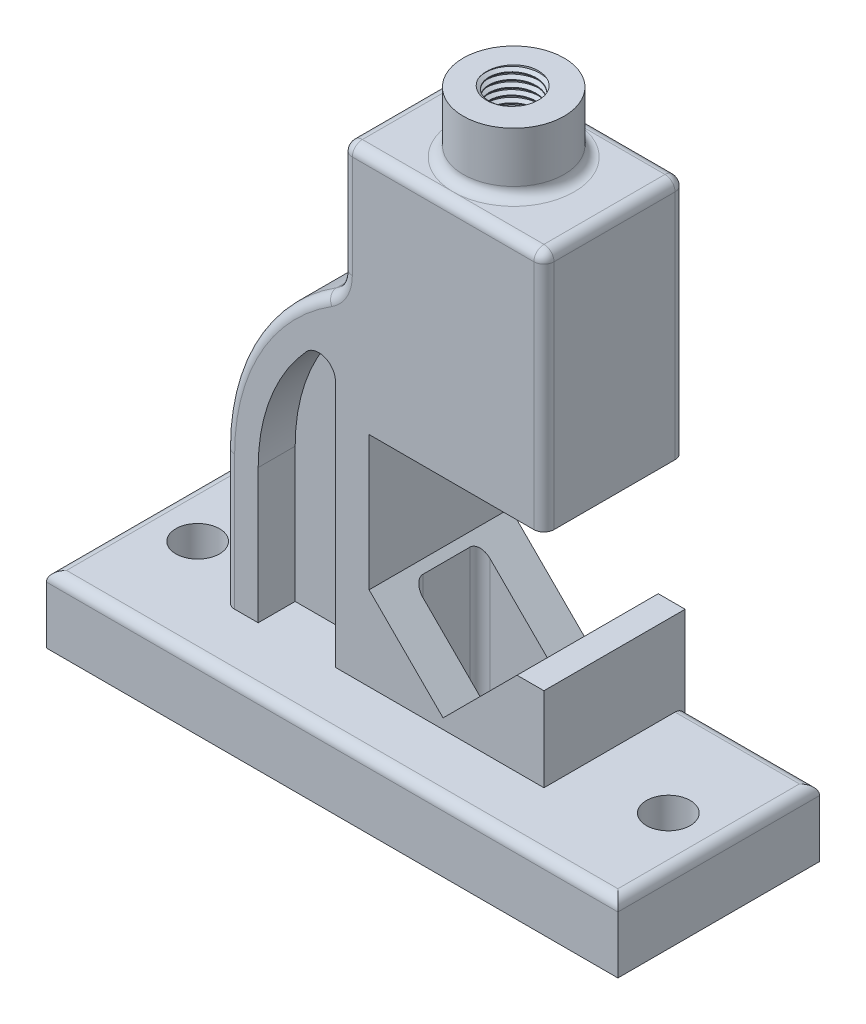
from build123d import *

# Parameters (mm, degrees)
BOSS_EXTRUDE1_DEPTH    = 60
BOSS_EXTRUDE2_DEPTH    = 42
SKETCH2_R              = 6.5
CUT_EXTRUDE1_DEPTH     = 60
BOSS_EXTRUDE3_START    = 11
BOSS_EXTRUDE3_DEPTH    = 20
CUT_EXTRUDE2_START     = 11
SKETCH3_W              = 40
SKETCH3_H              = 147
CUT_EXTRUDE2_DEPTH     = 20
SKETCH4_R              = 15
BOSS_EXTRUDE4_DEPTH    = 18
M16X2_0_TAPPED_HOLE1_D = 14
FILLET1_R              = 3
FILLET2_R              = 3
THREAD1_PITCH          = 2


with BuildPart() as part:
    # Sketch1 → Boss-Extrude1 (new body)
    with BuildSketch(Plane.XY):
        Polygon((-100, 20), (-100, 0), (-55, 0), (70, 0), (70, 20), (30, 20), (-32, 20), (-55, 20), (-65, 20), align=None)
    extrude(amount=BOSS_EXTRUDE1_DEPTH)

    # Sketch1<3> → Boss-Extrude2 (add)
    with BuildSketch(Plane.XY):
        with BuildLine():
            Line((-65, 60), (-65, 20))
            Line((-65, 20), (-55, 20))
            Line((-55, 20), (-55, 60))
            ThreePointArc((-55, 60), (-51.300584792, 79.830532015), (-40.7, 96.993377786))
            ThreePointArc((-40.7, 96.993377786), (-35.197224362, 98.294032968), (-32, 93.630343442))
            Line((-32, 93.630343442), (-32, 20))
            Line((-32, 20), (30, 20))
            Line((30, 20), (30, 45))
            Line((30, 45), (22, 45))
            Line((22, 45), (0, 23))
            Line((0, 23), (-22, 45))
            Line((-22, 45), (-22, 85))
            Line((-22, 85), (-20, 85))
            Line((-20, 85), (20, 85))
            Line((20, 85), (30, 85))
            Line((30, 85), (30, 157))
            Line((30, 157), (20, 157))
            Line((20, 157), (-20, 157))
            Line((-20, 157), (-30, 157))
            Line((-30, 157), (-30, 123.442887702))
            ThreePointArc((-30, 123.442887702), (-31.244049642, 118.612428787), (-34.666666667, 114.983836009))
            ThreePointArc((-34.666666667, 114.983836009), (-56.913677325, 91.39798295), (-65, 60))
        make_face()
    extrude(amount=BOSS_EXTRUDE2_DEPTH)

    # Sketch2 → Cut-Extrude1 (cut)
    with BuildSketch(Plane.XZ):
        with Locations((-85, 30)):
            Circle(SKETCH2_R)
        with Locations((55, 30)):
            Circle(SKETCH2_R)
    extrude(amount=-CUT_EXTRUDE1_DEPTH, mode=Mode.SUBTRACT)

    # Sketch1<6> → Boss-Extrude3 (add)
    with BuildSketch(Plane.XY.offset(BOSS_EXTRUDE3_START)):
        with BuildLine():
            Line((-55, 60), (-55, 20))
            Line((-55, 20), (-32, 20))
            Line((-32, 20), (-32, 93.630343442))
            ThreePointArc((-32, 93.630343442), (-35.197224362, 98.294032968), (-40.7, 96.993377786))
            ThreePointArc((-40.7, 96.993377786), (-51.300584792, 79.830532015), (-55, 60))
        make_face()
    extrude(amount=BOSS_EXTRUDE3_DEPTH)

    # Sketch3 → Cut-Extrude2 (cut)
    with BuildSketch(Plane.XY.offset(CUT_EXTRUDE2_START)):
        with Locations((0, 73.5)):
            Rectangle(SKETCH3_W, SKETCH3_H)
    extrude(amount=CUT_EXTRUDE2_DEPTH, mode=Mode.SUBTRACT)

    # Sketch4 → Boss-Extrude4 (add)
    with BuildSketch(Plane(origin=(0, 157, 0), x_dir=(1, 0, 0), z_dir=(0, 1, 0))):
        with Locations(Location((0, -21, 0), (0, 0, 180))):
            Circle(SKETCH4_R)
    extrude(amount=BOSS_EXTRUDE4_DEPTH)

    # M16x2.0 Tapped Hole1 (through all)
    with Locations(Plane(origin=(0, 175, 0), x_dir=(1, 0, 0), z_dir=(0, 1, 0))):
        with Locations((0, -21)):
            Hole(M16X2_0_TAPPED_HOLE1_D / 2)

    # Fillet1
    fillet1_edges = [part.edges().sort_by_distance(p)[0] for p in [
        (50, 20, 0),
        (-15, 20, 60),
        (-82.5, 20, 0),
        (70, 20, 30),
        (-100, 20, 30),
    ]]
    fillet(fillet1_edges, radius=FILLET1_R)

    # Fillet2
    fillet2_edges = [part.edges().sort_by_distance(p)[0] for p in [
        (-65, 38.5, 0),
        (-30, 140.221443851, 0),
        (-30, 140.221443851, 42),
        (-31.244049642, 118.612428787, 0),
        (-31.244049642, 118.612428787, 42),
        (-56.913677325, 91.39798295, 0),
        (-56.913677325, 91.39798295, 42),
        (30, 157, 21),
        (0, 157, 0),
        (0, 157, 42),
        (-30, 157, 21),
        (15, 157, 21),
        (30, 121, 0),
        (30, 121, 42),
        (-65, 40, 42),
        (20, 116, 31),
        (-20, 116, 31),
        (20, 116, 11),
        (-20, 116, 11),
        (20, 21.5, 31),
        (20, 21.5, 11),
        (-20, 21.5, 31),
        (-20, 21.5, 11),
    ]]
    fillet(fillet2_edges, radius=FILLET2_R - 0.0001)  # a hair under: the kernel refuses the full size

    # Thread1: the profile of Thread Profile1 profile screwed along a right-hand helix of 48.5 turns, 10 arcs to a turn; built about Z, then put on its axis
    thread1_z = Axis((0, 0, 0), (0, 0, 1))
    thread1_corners = [(6.9997, 0, -0.000173205), (6.9997, 0, 1.7501732), (8.08253175, 0, 1.124999997), (8.08253175, 0, 0.624999997)]
    with BuildLine(mode=Mode.PRIVATE) as thread1_profile:
        Line(thread1_corners[0], thread1_corners[1])
        Line(thread1_corners[1], thread1_corners[2])
        Line(thread1_corners[2], thread1_corners[3])
        Line(thread1_corners[3], thread1_corners[0])
    thread1_cap = Face(thread1_profile.wire())
    thread1_turn_angles = [0, 18, 36, 54, 72, 90, 108, 126, 144, 162, 180, 198, 216, 234, 252, 270, 288, 306, 324, 342, 360]
    thread1_turn_weights = [1, 0.9510565162951535, 1, 0.9510565162951535, 1, 0.9510565162951535, 1, 0.9510565162951535, 1, 0.9510565162951535, 1, 0.9510565162951535, 1, 0.9510565162951535, 1, 0.9510565162951535, 1, 0.9510565162951535, 1, 0.9510565162951535, 1]
    thread1_turn_rails = [Edge.make_bspline([Vector(p[0], p[1], 0).rotate(thread1_z, thread1_turn_angles[k]) / thread1_turn_weights[k] + Vector(0, 0, p[2] + THREAD1_PITCH * thread1_turn_angles[k] / 360) for k in range(21)], [0, 0, 0, 1, 1, 2, 2, 3, 3, 4, 4, 5, 5, 6, 6, 7, 7, 8, 8, 9, 9, 10, 10, 10], 2, thread1_turn_weights) for p in thread1_corners]
    thread1_turn_sides = [Face.make_surface_from_curves(thread1_turn_rails[p[0]], thread1_turn_rails[p[1]]) for p in [(0, 1), (1, 2), (2, 3), (3, 0)]]
    thread1_turn = Solid(Shell([*thread1_turn_sides, thread1_cap, thread1_cap.rotate(thread1_z, 360).moved(Location((0, 0, THREAD1_PITCH * 360 / 360)))]))
    thread1_last_angles = [17280, 17298, 17316, 17334, 17352, 17370, 17388, 17406, 17424, 17442, 17460]
    thread1_last_weights = [1, 0.9510565162951535, 1, 0.9510565162951535, 1, 0.9510565162951535, 1, 0.9510565162951535, 1, 0.9510565162951535, 1]
    thread1_last_rails = [Edge.make_bspline([Vector(p[0], p[1], 0).rotate(thread1_z, thread1_last_angles[k]) / thread1_last_weights[k] + Vector(0, 0, p[2] + THREAD1_PITCH * thread1_last_angles[k] / 360) for k in range(11)], [0, 0, 0, 1, 1, 2, 2, 3, 3, 4, 4, 5, 5, 5], 2, thread1_last_weights) for p in thread1_corners]
    thread1_last_sides = [Face.make_surface_from_curves(thread1_last_rails[p[0]], thread1_last_rails[p[1]]) for p in [(0, 1), (1, 2), (2, 3), (3, 0)]]
    thread1_last = Solid(Shell([*thread1_last_sides, thread1_cap.rotate(thread1_z, 17280).moved(Location((0, 0, THREAD1_PITCH * 17280 / 360))), thread1_cap.rotate(thread1_z, 17460).moved(Location((0, 0, THREAD1_PITCH * 17460 / 360)))]))
    thread1_each = [*[thread1_turn.moved(Location((0, 0, THREAD1_PITCH * i))) for i in range(48)], thread1_last]
    add(Plane(origin=(0, 178, 21), x_dir=(-1, 0, 0), z_dir=(0, -1, 0)) * Compound([thread1_each[i] for i in range(0, 49, 2)]), mode=Mode.SUBTRACT)
    add(Plane(origin=(0, 178, 21), x_dir=(-1, 0, 0), z_dir=(0, -1, 0)) * Compound([thread1_each[i] for i in range(1, 49, 2)]), mode=Mode.SUBTRACT)


solid = part.part
